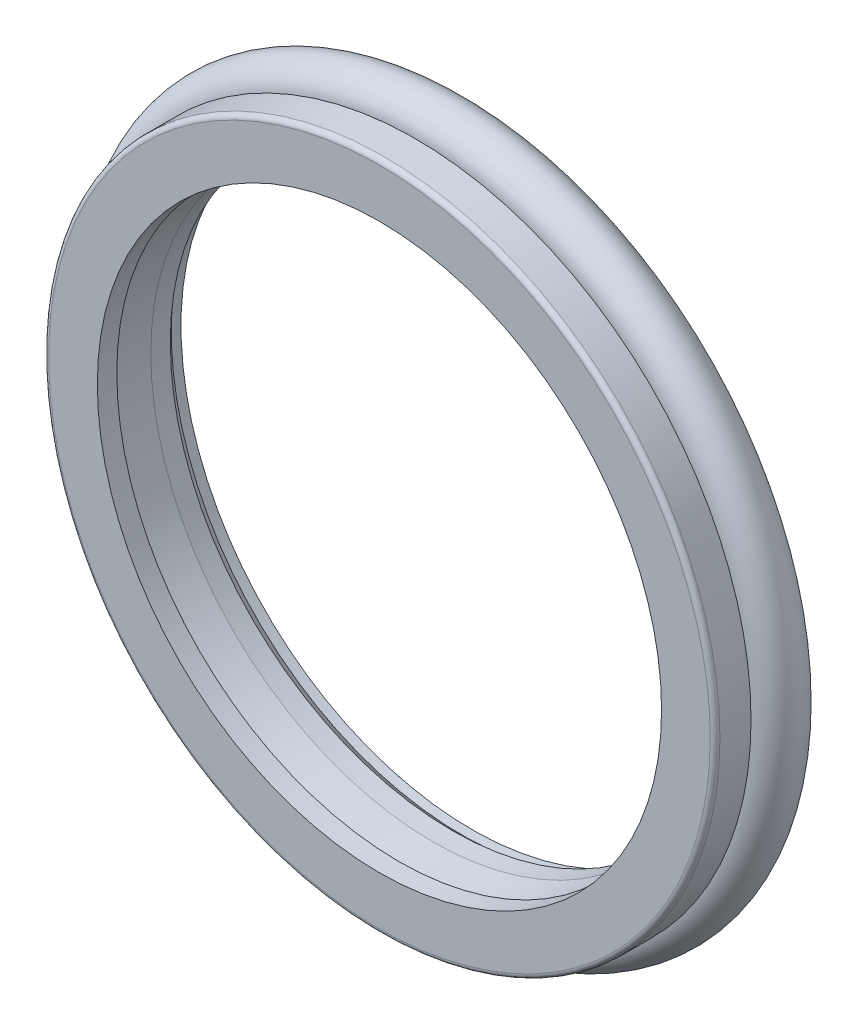
from build123d import *

# Parameters (mm, degrees)
SKETCH2_R = 1.3


with BuildPart() as part:
    # Sketch1 → Revolve1 (revolve)
    with BuildSketch(Plane(origin=(0, 0, 0), x_dir=(0, 0, -1), z_dir=(1, 0, 0))):
        with BuildLine():
            Line((0.25, 17.25), (1.85, 17.25))
            Line((1.85, 17.25), (1.85, 15.75))
            Line((1.85, 15.75), (4.75, 15.75))
            Line((4.75, 15.75), (4.75, 14.95))
            Line((4.75, 14.95), (4.25, 14.95))
            Line((4.25, 14.95), (3.75, 14.5))
            Line((3.75, 14.5), (2.75, 14.5))
            Line((2.75, 14.5), (1, 14.7))
            Line((1, 14.7), (1, 14.5))
            Line((1, 14.5), (0, 14.5))
            Line((0, 14.5), (0, 17))
            ThreePointArc((0, 17), (0.073223305, 17.176776695), (0.25, 17.25))
        make_face()
    revolve(axis=Axis((0, 0, 0), (0, 0, -1)))


with BuildPart() as body_2:
    # Sketch2 → Revolve2 (revolve)
    with BuildSketch(Plane(origin=(0, 0, 0), x_dir=(0, 0, -1), z_dir=(1, 0, 0))):
        with Locations((3.3, 17.05)):
            Circle(SKETCH2_R)
    revolve(axis=Axis((0, 0, 0), (0, 0, -1)))


solid = Compound([part.part, body_2.part])
